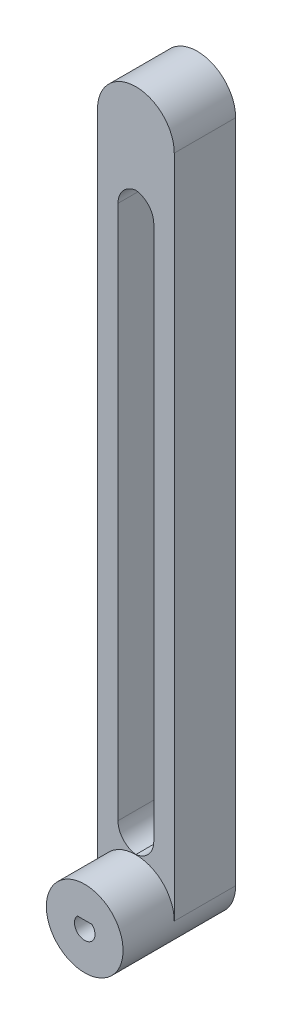
from build123d import *

# Parameters (mm, degrees)
BOSS_EXTRUDE1_DEPTH = 12
SKETCH2_R           = 3.1
BOSS_EXTRUDE2_DEPTH = 15
CUT_EXTRUDE1_START  = -50
CUT_EXTRUDE1_DEPTH  = 50
CUT_EXTRUDE2_START  = -15
CUT_EXTRUDE2_DEPTH  = 15
SKETCH5_W           = 7
SKETCH5_H           = 112.5
CUT_EXTRUDE3_DEPTH  = 12
SKETCH6_R           = 5.15
CUT_EXTRUDE4_DEPTH  = 2
FILLET1_R           = 4
BOSS_EXTRUDE3_DEPTH = 10
SKETCH9_R           = 2.1
CUT_EXTRUDE5_DEPTH  = 7
BOSS_EXTRUDE4_DEPTH = 7
SKETCH11_W          = 3.391399245
SKETCH11_H          = 0.49647288
BOSS_EXTRUDE7_DEPTH = 7
BOSS_EXTRUDE8_DEPTH = 10


with BuildPart() as part:
    # Sketch1 → Boss-Extrude1 (new body)
    with BuildSketch(Plane.XY):
        with BuildLine():
            Line((-5.64516129, 102.580645161), (-5.64516129, -27.419354839))
            ThreePointArc((-5.64516129, -27.419354839), (1.85483871, -34.919354839), (9.35483871, -27.419354839))
            Line((9.35483871, -27.419354839), (9.35483871, 102.580645161))
            ThreePointArc((9.35483871, 102.580645161), (1.85483871, 110.080645161), (-5.64516129, 102.580645161))
        make_face()
    extrude(amount=BOSS_EXTRUDE1_DEPTH)

    # Sketch2 → Boss-Extrude2 (add)
    with BuildSketch(Plane.XY.offset(12)):
        with Locations(Location((1.85483871, -27.419354839, 0), (0, 0, 180))):
            Circle(SKETCH2_R)
    extrude(amount=BOSS_EXTRUDE2_DEPTH)

    # Sketch3 → Cut-Extrude1 (cut)
    with BuildSketch(Plane.XY.offset(27).offset(CUT_EXTRUDE1_START)):
        with BuildLine():
            Line((0.166644408, -24.819354839), (3.543033011, -24.819354839))
            ThreePointArc((3.543033011, -24.819354839), (1.85483871, -30.519354839), (0.166644408, -24.819354839))
        make_face()
    extrude(amount=CUT_EXTRUDE1_DEPTH, mode=Mode.SUBTRACT)

    # Sketch4 → Cut-Extrude2 (cut)
    with BuildSketch(Plane.XY.offset(27).offset(CUT_EXTRUDE2_START)):
        with BuildLine():
            Line((0.166644408, -24.819354839), (3.543033011, -24.819354839))
            ThreePointArc((3.543033011, -24.819354839), (1.85483871, -24.319354839), (0.166644408, -24.819354839))
        make_face()
    extrude(amount=CUT_EXTRUDE2_DEPTH, mode=Mode.SUBTRACT)

    # Sketch5 → Cut-Extrude3 (cut)
    with BuildSketch(Plane.XY.offset(12)):
        with Locations((1.85483871, 36.330645161)):
            Rectangle(SKETCH5_W, SKETCH5_H)
    extrude(amount=-CUT_EXTRUDE3_DEPTH, mode=Mode.SUBTRACT)

    # Sketch6 → Cut-Extrude4 (cut)
    with BuildSketch(Plane.ZY.offset(5.64516129)):
        with Locations(Location((6, 78.768969581, 0), (0, 0, 270))):
            Circle(SKETCH6_R)
        with Locations(Location((6, 53.768969581, 0), (0, 0, 270))):
            Circle(SKETCH6_R)
        with Locations(Location((6, 28.768969581, 0), (0, 0, 270))):
            Circle(SKETCH6_R)
    extrude(amount=-CUT_EXTRUDE4_DEPTH, mode=Mode.SUBTRACT)

    # Fillet1
    # the kernel refuses this fillet: 4 mm, written as the material it adds along each edge
    with BuildSketch(Plane(origin=(-1.64516129, -19.919354839, 12), x_dir=(0, 1, 0), z_dir=(0, 0, -1)), Plane(origin=(5.35483871, -19.919354839, 12), x_dir=(-1, 0, 0), z_dir=(0, 0, -1)), Plane(origin=(5.35483871, 92.580645161, 12), x_dir=(0, -1, 0), z_dir=(0, 0, -1))) as fillet1_piece_1:
        with BuildLine():
            CenterArc((FILLET1_R, FILLET1_R), FILLET1_R, 180, 90)
            Line((0, FILLET1_R), (0, 0))
            Line((0, 0), (FILLET1_R, 0))
        make_face()
    extrude(amount=12)
    with BuildSketch(Plane(origin=(-1.64516129, 92.580645161, 12), x_dir=(0, -1, 0), z_dir=(0, 0, -1))) as fillet1_piece_2:
        with BuildLine():
            CenterArc((FILLET1_R, -FILLET1_R), FILLET1_R, 90, 90)
            Line((0, -FILLET1_R), (0, 0))
            Line((0, 0), (FILLET1_R, 0))
        make_face()
    extrude(amount=12)

    # Sketch7 → Boss-Extrude3 (add)
    with BuildSketch(Plane.XY.offset(12)):
        with BuildLine():
            ThreePointArc((-5.64516129, -27.419354839), (1.85483871, -34.919354839), (9.35483871, -27.419354839))
            ThreePointArc((9.35483871, -27.419354839), (1.85483871, -19.919354839), (-5.64516129, -27.419354839))
        make_face()
    extrude(amount=BOSS_EXTRUDE3_DEPTH)

    # Sketch9 → Cut-Extrude5 (cut)
    with BuildSketch(Plane.XY.offset(22)):
        with Locations((1.85483871, -27.419354839)):
            Circle(SKETCH9_R)
    extrude(amount=-CUT_EXTRUDE5_DEPTH, mode=Mode.SUBTRACT)

    # Sketch10 → Boss-Extrude4 (add)
    with BuildSketch(Plane.XY.offset(22)):
        with BuildLine():
            Line((0.694020033, -25.669354839), (3.015657386, -25.669354839))
            ThreePointArc((3.015657386, -25.669354839), (1.85483871, -25.319354839), (0.694020033, -25.669354839))
        make_face()
    extrude(amount=-BOSS_EXTRUDE4_DEPTH)

    # Sketch11 → Boss-Extrude7 (add)
    with BuildSketch(Plane.XY.offset(22)):
        with Locations((1.841860982, -25.665070635)):
            Rectangle(SKETCH11_W, SKETCH11_H)
    extrude(amount=-BOSS_EXTRUDE7_DEPTH)

    # Sketch12 → Boss-Extrude8 (add)
    with BuildSketch(Plane.XY.offset(22)):
        with BuildLine():
            Line((0.39134285, -25.913307075), (3.31833457, -25.913307075))
            ThreePointArc((3.31833457, -25.913307075), (1.85483871, -29.519354839), (0.39134285, -25.913307075))
        make_face()
        with BuildLine():
            Line((3.281340981, -26.003307075), (0.428336439, -26.003307075))
            ThreePointArc((0.428336439, -26.003307075), (1.85483871, -29.429354839), (3.281340981, -26.003307075))
        make_face(mode=Mode.SUBTRACT)
    extrude(amount=-BOSS_EXTRUDE8_DEPTH)


solid = part.part
